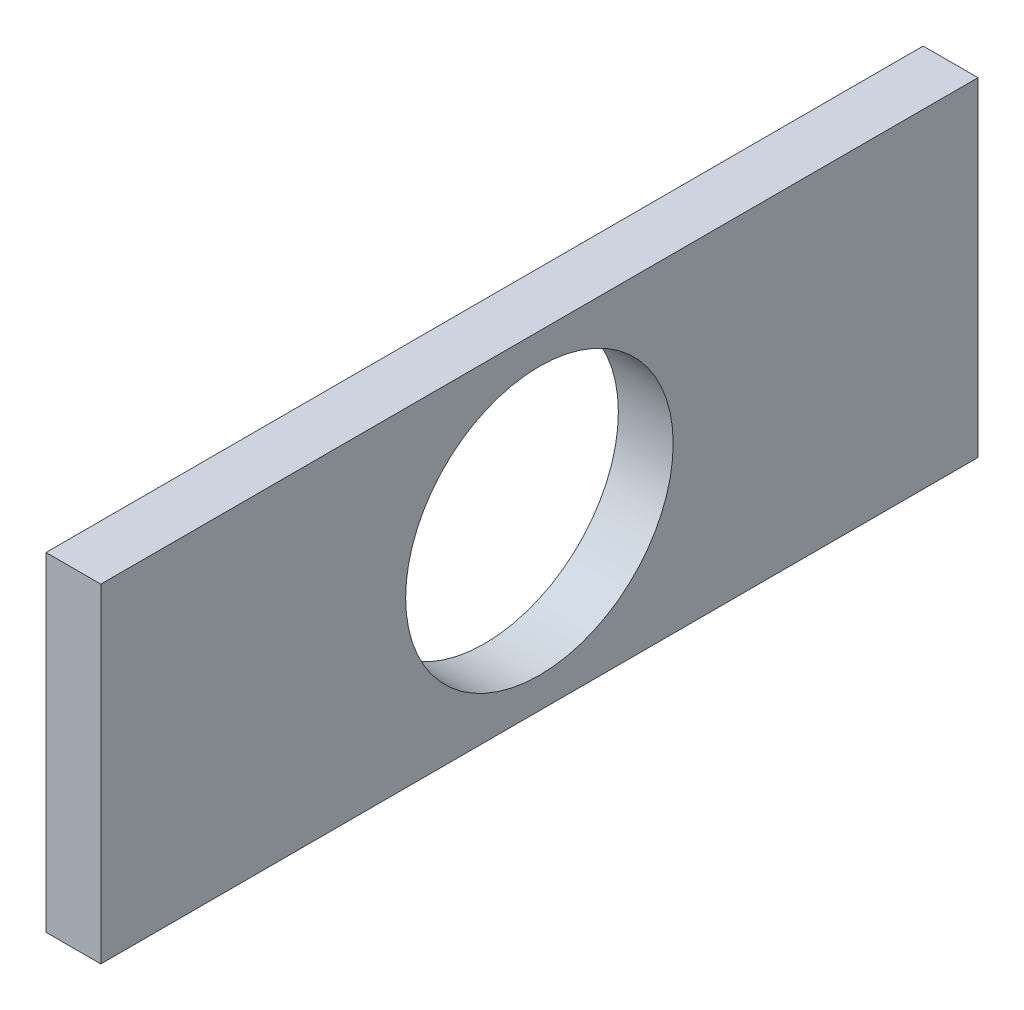
from build123d import *

# Parameters (mm, degrees)
SKETCH1_W           = 101.6
SKETCH1_H           = 38.1
SKETCH1_R           = 15.494
BOSS_EXTRUDE1_DEPTH = 6.35


with BuildPart() as part:
    # Sketch1 → Boss-Extrude1 (new body)
    with BuildSketch(Plane(origin=(0, 0, 0), x_dir=(0, 0, -1), z_dir=(1, 0, 0))):
        Rectangle(SKETCH1_W, SKETCH1_H)
        Circle(SKETCH1_R, mode=Mode.SUBTRACT)
    extrude(amount=BOSS_EXTRUDE1_DEPTH)


solid = part.part
